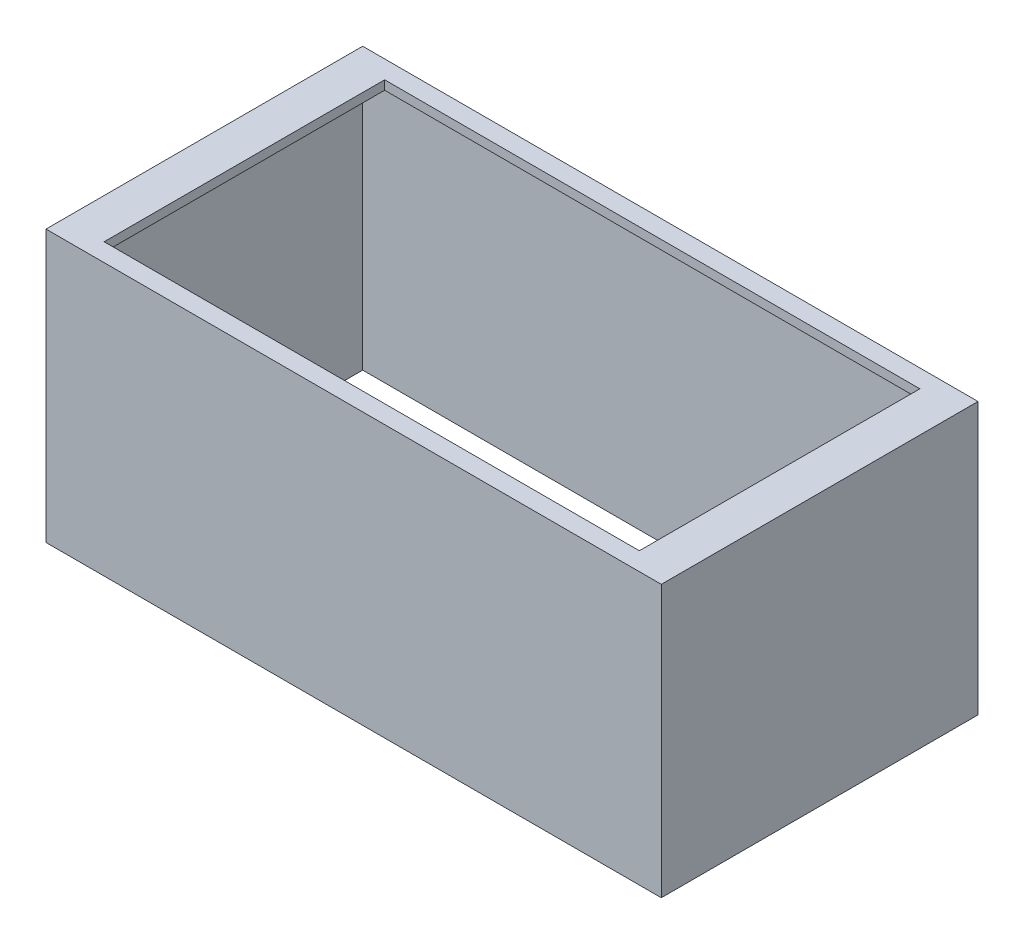
from build123d import *

# Parameters (mm, degrees)
SKETCH_1_W          = 136
SKETCH_1_H          = 70
EXTRUDE_1_DEPTH     = 60
SKETCH_2_W          = 118.3
SKETCH_2_H          = 62
CUT_EXTRUDE_1_DEPTH = 2
SKETCH_3_W          = 132
SKETCH_3_H          = 66
CUT_EXTRUDE_2_DEPTH = 58


with BuildPart() as part:
    # 草图1 → 凸台-拉伸1 (new body)
    with BuildSketch(Plane(origin=(0, 0, 0), x_dir=(1, 0, 0), z_dir=(0, 1, 0))):
        Rectangle(SKETCH_1_W, SKETCH_1_H)
    extrude(amount=EXTRUDE_1_DEPTH)

    # 草图2 → 切除-拉伸1 (cut)
    with BuildSketch(Plane(origin=(0, 60, 0), x_dir=(1, 0, 0), z_dir=(0, 1, 0))):
        Rectangle(SKETCH_2_W, SKETCH_2_H)
    extrude(amount=-CUT_EXTRUDE_1_DEPTH, mode=Mode.SUBTRACT)

    # 草图3 → 切除-拉伸2 (cut)
    with BuildSketch(Plane.XZ):
        Rectangle(SKETCH_3_W, SKETCH_3_H)
    extrude(amount=-CUT_EXTRUDE_2_DEPTH, mode=Mode.SUBTRACT)


solid = part.part
